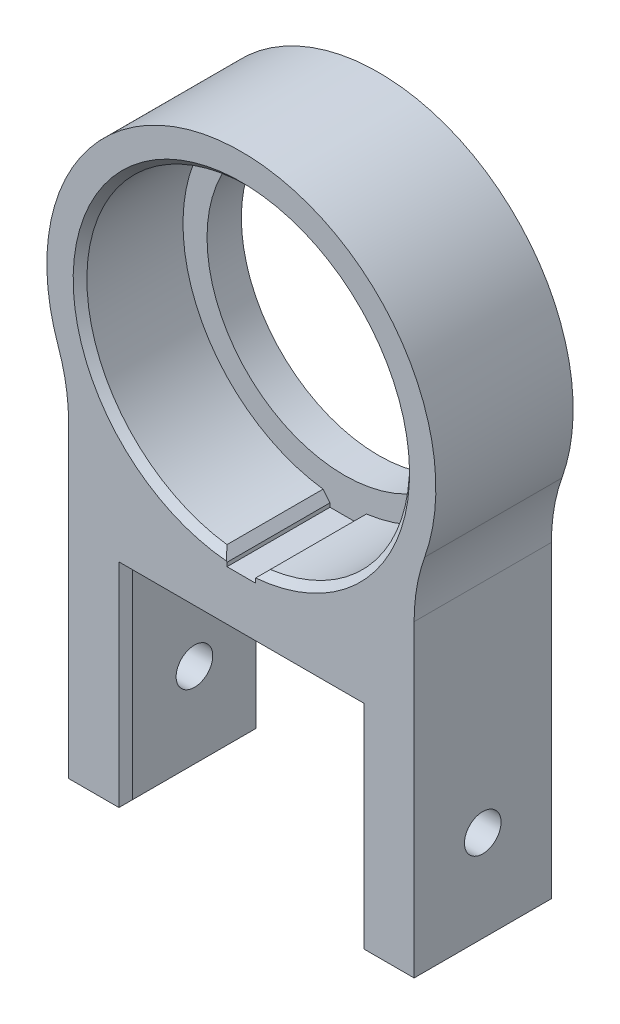
from build123d import *

# Parameters (mm, degrees)
SKETCH1_R               = 12
BOSS_EXTRUDE1_DEPTH     = 12
SKETCH9_R               = 14.1
CUT_EXTRUDE2_DEPTH      = 9
SKETCH7_R               = 14
SKETCH7_R_2             = 12
BOSS_EXTRUDE3_DEPTH     = 3
CUT_EXTRUDE5_DEPTH      = 49.191389272
CUT_EXTRUDE5_DEPTH_BACK = 49.191389272
SKETCH12_R              = 1.6
SKETCH13_W              = 2.5
SKETCH13_H              = 1
CUT_EXTRUDE6_DEPTH      = 9
CHAMFER1_SIZE           = 0.6
CHAMFER1_SIZE_2         = 0.661222502


with BuildPart() as part:
    # Sketch1 → Boss-Extrude1 (new body)
    with BuildSketch(Plane.XY):
        with BuildLine():
            Line((-15.1, -38), (-10.1, -38))
            Line((-10.1, -38), (-10.1, -20))
            Line((-10.1, -20), (10.1, -20))
            Line((10.1, -20), (10.1, -38))
            Line((10.1, -38), (15.1, -38))
            Line((15.1, -38), (15.1, -11.029534738))
            ThreePointArc((15.1, -11.029534738), (15.331712472, -8.319532432), (16.020123134, -5.688203124))
            ThreePointArc((16.020123134, -5.688203124), (0, 17), (-16.020123134, -5.688203124))
            ThreePointArc((-16.020123134, -5.688203124), (-15.331712472, -8.319532432), (-15.1, -11.029534738))
            Line((-15.1, -11.029534738), (-15.1, -38))
        make_face()
        Circle(SKETCH1_R, mode=Mode.SUBTRACT)
    extrude(amount=BOSS_EXTRUDE1_DEPTH)

    # Sketch9 → Cut-Extrude2 (cut)
    with BuildSketch(Plane.XY.offset(12)):
        Circle(SKETCH9_R)
    extrude(amount=-CUT_EXTRUDE2_DEPTH, mode=Mode.SUBTRACT)

    # Sketch7 → Boss-Extrude3 (add)
    with BuildSketch(Plane.XY):
        Circle(SKETCH7_R)
        with Locations(Location((0, 0, 0), (0, 0, 180))):
            Circle(SKETCH7_R_2, mode=Mode.SUBTRACT)
    extrude(amount=BOSS_EXTRUDE3_DEPTH)

    # Sketch12 → Cut-Extrude5 (cut, two sides: drawn at the far end of the back side and taken through both)
    with BuildSketch(Plane.ZY.offset(-10.1).offset(-CUT_EXTRUDE5_DEPTH_BACK)):
        with Locations(Location((6, -30, 0), (0, 0, 270))):
            Circle(SKETCH12_R)
    extrude(amount=CUT_EXTRUDE5_DEPTH + CUT_EXTRUDE5_DEPTH_BACK, mode=Mode.SUBTRACT)

    # Sketch13 → Cut-Extrude6 (cut)
    with BuildSketch(Plane.XY.offset(12)):
        with Locations((0, -14.544482903)):
            Rectangle(SKETCH13_W, SKETCH13_H)
    extrude(amount=-CUT_EXTRUDE6_DEPTH, mode=Mode.SUBTRACT)

    # Chamfer1
    # the kernel refuses this chamfer: 0.661222502, 0.6 mm, written as the material it takes off along each edge
    with BuildSketch(Plane(origin=(10.1, -20, 0), x_dir=(0, 0, 1), z_dir=(0, -1, 0)), Plane(origin=(-10.1, -39.543009793, 0), x_dir=(0, 0, 1), z_dir=(0, 1, 0))) as chamfer1_piece_1:
        Polygon((CHAMFER1_SIZE, 0), (0, -CHAMFER1_SIZE), (0, 0), align=None)
    extrude(amount=19.543009793, mode=Mode.SUBTRACT)
    with BuildSketch(Plane(origin=(-10.1, -20, 0), x_dir=(0, 0, 1), z_dir=(1, 0, 0))) as chamfer1_piece_2:
        Polygon((CHAMFER1_SIZE, 0), (0, -CHAMFER1_SIZE), (0, 0), align=None)
    extrude(amount=20.2, mode=Mode.SUBTRACT)
    with BuildSketch(Plane(origin=(-10.1, -39.543009793, 12), x_dir=(0, 0, -1), z_dir=(0, 1, 0)), Plane(origin=(10.1, -20, 12), x_dir=(0, 0, -1), z_dir=(0, -1, 0))) as chamfer1_piece_3:
        Polygon((CHAMFER1_SIZE, 0), (0, CHAMFER1_SIZE), (0, 0), align=None)
    extrude(amount=19.543009793, mode=Mode.SUBTRACT)
    with BuildSketch(Plane(origin=(10.1, -38, -1.543009793), x_dir=(0, 1, 0), z_dir=(0, 0, 1))) as chamfer1_piece_4:
        Polygon((CHAMFER1_SIZE, 0), (0, -CHAMFER1_SIZE), (0, 0), align=None)
    extrude(amount=15.086019586, mode=Mode.SUBTRACT)
    with BuildSketch(Plane(origin=(-10.1, -38, -1.543009793), x_dir=(0, 1, 0), z_dir=(0, 0, 1))) as chamfer1_piece_5:
        Polygon((CHAMFER1_SIZE, 0), (0, CHAMFER1_SIZE), (0, 0), align=None)
    extrude(amount=15.086019586, mode=Mode.SUBTRACT)
    with BuildSketch(Plane(origin=(-10.1, -20, 12), x_dir=(0, 0, -1), z_dir=(1, 0, 0))) as chamfer1_piece_6:
        Polygon((CHAMFER1_SIZE, 0), (0, CHAMFER1_SIZE), (0, 0), align=None)
    extrude(amount=20.2, mode=Mode.SUBTRACT)
    with BuildSketch(Plane(origin=(-1.25, -14.044482903, 13.704300801), x_dir=(0, -1, 0), z_dir=(0, 0, -1))) as chamfer1_piece_7:
        with BuildLine():
            Line((CHAMFER1_SIZE_2, 0), (-0.06766867, 0.609748345))
            ThreePointArc((-0.06766867, 0.609748345), (-0.031575454, 0.314744335), (0, 0))
            Line((0, 0), (CHAMFER1_SIZE_2, 0))
        make_face()
    extrude(amount=10.704300801, mode=Mode.SUBTRACT)
    with BuildSketch(Plane(origin=(1.25, -14.044482903, 13.754921918), x_dir=(0, -1, 0), z_dir=(0, 0, -1))) as chamfer1_piece_8:
        with BuildLine():
            Line((CHAMFER1_SIZE, 0), (-0.07674701, -0.67674701))
            ThreePointArc((-0.07674701, -0.67674701), (-0.035457258, -0.349124916), (0, 0))
            Line((0, 0), (CHAMFER1_SIZE, 0))
        make_face()
    extrude(amount=10.754921918, mode=Mode.SUBTRACT)
    with BuildSketch(Plane(origin=(-10.1, -20, 0), x_dir=(0, 0, 1), z_dir=(1, 0, 0))) as chamfer1_piece_9a_section:
        Polygon((CHAMFER1_SIZE, 0), (0, -CHAMFER1_SIZE), (0, 0), align=None)
    chamfer1_piece_9a = extrude(amount=21.743009793, mode=Mode.PRIVATE)
    chamfer1_piece_9a = split(chamfer1_piece_9a, bisect_by=Plane(origin=(10.1, -20, 0), z_dir=(1, 0, 0)), keep=Keep.TOP, mode=Mode.PRIVATE)
    with BuildSketch(Plane(origin=(10.1, -18.456990207, 0), x_dir=(0, 0, 1), z_dir=(0, -1, 0))) as chamfer1_piece_9b_section:
        Polygon((CHAMFER1_SIZE, 0), (0, -CHAMFER1_SIZE), (0, 0), align=None)
    chamfer1_piece_9b = extrude(amount=19.543009793, mode=Mode.PRIVATE)
    chamfer1_piece_9b = split(chamfer1_piece_9b, bisect_by=Plane(origin=(10.1, -20, 0), z_dir=(0, 1, 0)), keep=Keep.TOP, mode=Mode.PRIVATE)
    chamfer1_piece_9 = chamfer1_piece_9a & chamfer1_piece_9b
    add(chamfer1_piece_9, mode=Mode.SUBTRACT)
    with BuildSketch(Plane(origin=(-10.1, -38, 0), x_dir=(0, 0, 1), z_dir=(0, 1, 0))) as chamfer1_piece_10a_section:
        Polygon((CHAMFER1_SIZE, 0), (0, -CHAMFER1_SIZE), (0, 0), align=None)
    chamfer1_piece_10a = extrude(amount=19.543009793, mode=Mode.PRIVATE)
    chamfer1_piece_10a = split(chamfer1_piece_10a, bisect_by=Plane(origin=(-10.1, -20, 0), z_dir=(0, 1, 0)), keep=Keep.TOP, mode=Mode.PRIVATE)
    with BuildSketch(Plane(origin=(-11.643009793, -20, 0), x_dir=(0, 0, 1), z_dir=(1, 0, 0))) as chamfer1_piece_10b_section:
        Polygon((CHAMFER1_SIZE, 0), (0, -CHAMFER1_SIZE), (0, 0), align=None)
    chamfer1_piece_10b = extrude(amount=21.743009793, mode=Mode.PRIVATE)
    chamfer1_piece_10b = split(chamfer1_piece_10b, bisect_by=Plane(origin=(-10.1, -20, 0), z_dir=(-1, 0, 0)), keep=Keep.TOP, mode=Mode.PRIVATE)
    chamfer1_piece_10 = chamfer1_piece_10a & chamfer1_piece_10b
    add(chamfer1_piece_10, mode=Mode.SUBTRACT)
    with BuildSketch(Plane(origin=(-10.1, -38, 12), x_dir=(0, 0, -1), z_dir=(0, 1, 0))) as chamfer1_piece_11a_section:
        Polygon((CHAMFER1_SIZE, 0), (0, CHAMFER1_SIZE), (0, 0), align=None)
    chamfer1_piece_11a = extrude(amount=19.543009793, mode=Mode.PRIVATE)
    chamfer1_piece_11a = split(chamfer1_piece_11a, bisect_by=Plane(origin=(-10.1, -20, 12), z_dir=(0, 1, 0)), keep=Keep.TOP, mode=Mode.PRIVATE)
    with BuildSketch(Plane(origin=(-11.643009793, -20, 12), x_dir=(0, 0, -1), z_dir=(1, 0, 0))) as chamfer1_piece_11b_section:
        Polygon((CHAMFER1_SIZE, 0), (0, CHAMFER1_SIZE), (0, 0), align=None)
    chamfer1_piece_11b = extrude(amount=21.743009793, mode=Mode.PRIVATE)
    chamfer1_piece_11b = split(chamfer1_piece_11b, bisect_by=Plane(origin=(-10.1, -20, 12), z_dir=(-1, 0, 0)), keep=Keep.TOP, mode=Mode.PRIVATE)
    chamfer1_piece_11 = chamfer1_piece_11a & chamfer1_piece_11b
    add(chamfer1_piece_11, mode=Mode.SUBTRACT)
    with BuildSketch(Plane(origin=(-10.1, -20, 12), x_dir=(0, 0, -1), z_dir=(1, 0, 0))) as chamfer1_piece_12a_section:
        Polygon((CHAMFER1_SIZE, 0), (0, CHAMFER1_SIZE), (0, 0), align=None)
    chamfer1_piece_12a = extrude(amount=21.743009793, mode=Mode.PRIVATE)
    chamfer1_piece_12a = split(chamfer1_piece_12a, bisect_by=Plane(origin=(10.1, -20, 12), z_dir=(1, 0, 0)), keep=Keep.TOP, mode=Mode.PRIVATE)
    with BuildSketch(Plane(origin=(10.1, -18.456990207, 12), x_dir=(0, 0, -1), z_dir=(0, -1, 0))) as chamfer1_piece_12b_section:
        Polygon((CHAMFER1_SIZE, 0), (0, CHAMFER1_SIZE), (0, 0), align=None)
    chamfer1_piece_12b = extrude(amount=19.543009793, mode=Mode.PRIVATE)
    chamfer1_piece_12b = split(chamfer1_piece_12b, bisect_by=Plane(origin=(10.1, -20, 12), z_dir=(0, 1, 0)), keep=Keep.TOP, mode=Mode.PRIVATE)
    chamfer1_piece_12 = chamfer1_piece_12a & chamfer1_piece_12b
    add(chamfer1_piece_12, mode=Mode.SUBTRACT)
    # the kernel refuses this chamfer: 0.661222502, 0.6 mm, written as the material it takes off along each edge
    with BuildSketch(Plane(origin=(0, 0, 12), x_dir=(-0.02220052669057942, -0.9997535379355558, 0), z_dir=(0.9997535379355558, -0.02220052669057942, 0))) as chamfer1_2_piece_1:
        Polygon((14.1 + CHAMFER1_SIZE, 0), (14.1, CHAMFER1_SIZE), (14.1, 0), align=None)
    revolve(axis=Axis((0, 0, 12), (0, 0, -1)), revolution_arc=357.181058693, mode=Mode.SUBTRACT)


solid = part.part
